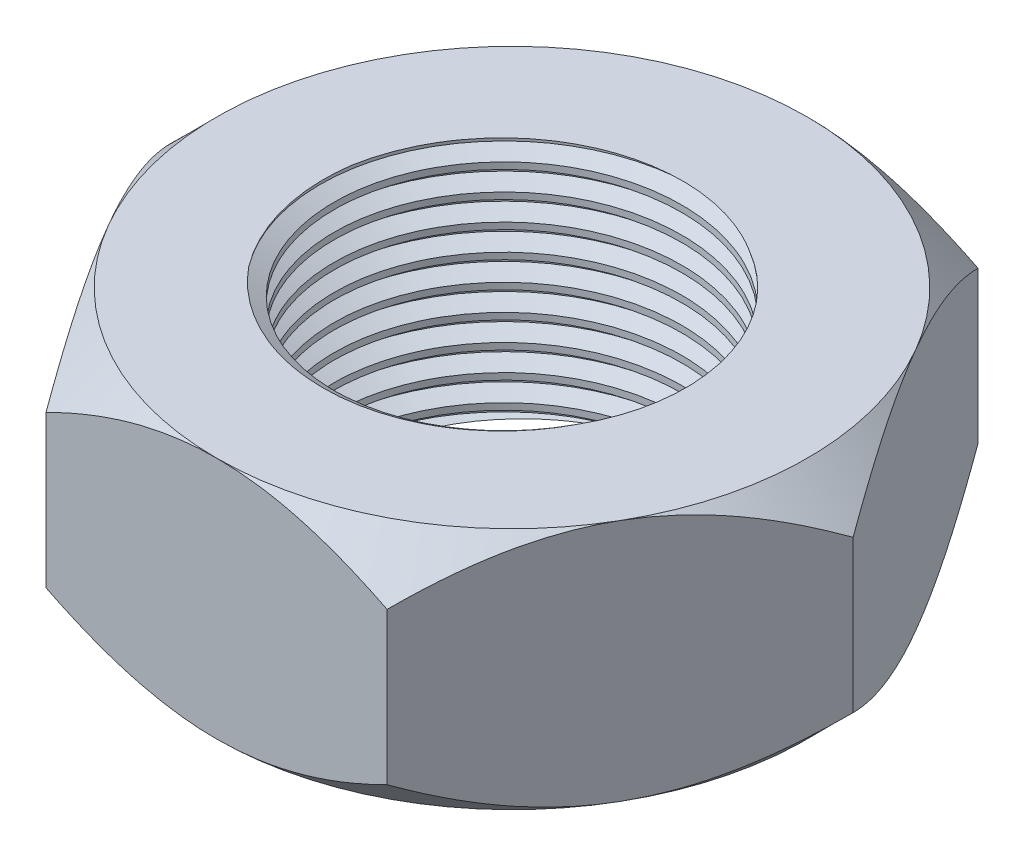
from build123d import *

# Parameters (mm, degrees)
BOSS_EXTRUDE1_DEPTH          = 7
SKETCH2_OUTSIDE_W            = 80.018
SKETCH2_OUTSIDE_H            = 74.758
SKETCH2_OUTSIDE_R            = 17
CUT_EXTRUDE1_DEPTH           = 7
CUT_EXTRUDE1_TAPER           = 45
CUT_EXTRUDE1_OTHER_WAY_DEPTH = 7
CUT_EXTRUDE1_OTHER_WAY_DRAFT = -45
MIRROR1_COPY_1_SKETCH_W      = 80.018
MIRROR1_COPY_1_SKETCH_H      = 74.758
MIRROR1_COPY_1_SKETCH_R      = 17
MIRROR1_COPY_1_DEPTH         = 7
MIRROR1_COPY_1_DRAFT         = -45
MIRROR1_COPY_2_SKETCH_W      = 80.018
MIRROR1_COPY_2_SKETCH_H      = 74.758
MIRROR1_COPY_2_SKETCH_R      = 17
MIRROR1_COPY_2_DEPTH         = 7
MIRROR1_COPY_2_DRAFT         = -45
CUT_EXTRUDE2_REACH           = 31.501
SKETCH3_R                    = 10
THREAD1_PITCH                = 1.5


with BuildPart() as part:
    # Sketch1 → Boss-Extrude1 (new, symmetric)
    with BuildSketch(Plane(origin=(0, 0, 0), x_dir=(1, 0, 0), z_dir=(0, 1, 0))):
        Polygon((19.629909152, 0), (9.814954576, 17), (-9.814954576, 17), (-19.629909152, 0), (-9.814954576, -17), (9.814954576, -17), align=None)
    extrude(amount=BOSS_EXTRUDE1_DEPTH, both=True)

    # Sketch2 outside → Cut-Extrude1 (cut)
    with BuildSketch(Plane(origin=(0, 7, 0), x_dir=(1, 0, 0), z_dir=(0, 1, 0))):
        Rectangle(SKETCH2_OUTSIDE_W, SKETCH2_OUTSIDE_H)
        Circle(SKETCH2_OUTSIDE_R, mode=Mode.SUBTRACT)
    cut_extrude1 = extrude(amount=CUT_EXTRUDE1_DEPTH, taper=CUT_EXTRUDE1_TAPER, mode=Mode.SUBTRACT)


with BuildPart() as cut_extrude1_other_way_tool:
    # Sketch2 outside → Cut-Extrude1 other way (with draft: the straight prism first)
    with BuildSketch(Plane(origin=(0, 7, 0), x_dir=(1, 0, 0), z_dir=(0, 1, 0))):
        Rectangle(SKETCH2_OUTSIDE_W, SKETCH2_OUTSIDE_H)
        Circle(SKETCH2_OUTSIDE_R, mode=Mode.SUBTRACT)
    extrude(amount=-CUT_EXTRUDE1_OTHER_WAY_DEPTH)
    # Cut-Extrude1 other way: the draft: its side faces are tilted about the plane it starts from
    cut_extrude1_other_way_sides = [cut_extrude1_other_way_tool.faces().sort_by_distance(p)[0] for p in [
        (0, 3.5, 37.379),
        (40.009, 3.5, 0),
        (0, 3.5, -37.379),
        (-40.009, 3.5, 0),
        (-17, 3.5, 0),
    ]]
    draft(cut_extrude1_other_way_sides, Plane(origin=(0, 7, 0), x_dir=(1, 0, 0), z_dir=(0, 1, 0)), CUT_EXTRUDE1_OTHER_WAY_DRAFT)


with BuildPart() as part_1:
    add(part.part)

    # Cut-Extrude1 other way: cut by cut_extrude1_other_way_tool
    add(cut_extrude1_other_way_tool.part, mode=Mode.SUBTRACT)

    # Mirror1: Cut-Extrude1 across plane
    add(cut_extrude1.mirror(Plane.ZX), mode=Mode.SUBTRACT)


with BuildPart() as mirror1_copy_1_tool:
    # Mirror1 copy 1 sketch → Mirror1 copy 1 (with draft: the straight prism first)
    with BuildSketch(Plane.XZ.offset(7)):
        Rectangle(MIRROR1_COPY_1_SKETCH_W, MIRROR1_COPY_1_SKETCH_H)
        Circle(MIRROR1_COPY_1_SKETCH_R, mode=Mode.SUBTRACT)
    extrude(amount=-MIRROR1_COPY_1_DEPTH)
    # Mirror1 copy 1: the draft: its side faces are tilted about the plane it starts from
    mirror1_copy_1_sides = [mirror1_copy_1_tool.faces().sort_by_distance(p)[0] for p in [
        (0, -3.5, 37.379),
        (40.009, -3.5, 0),
        (0, -3.5, -37.379),
        (-40.009, -3.5, 0),
        (-17, -3.5, 0),
    ]]
    draft(mirror1_copy_1_sides, Plane.XZ.offset(7), MIRROR1_COPY_1_DRAFT)


with BuildPart() as part_2:
    add(part_1.part)

    # Mirror1 copy 1: cut by mirror1_copy_1_tool
    add(mirror1_copy_1_tool.part, mode=Mode.SUBTRACT)


with BuildPart() as mirror1_copy_2_tool:
    # Mirror1 copy 2 sketch → Mirror1 copy 2 (with draft: the straight prism first)
    with BuildSketch(Plane.XZ.offset(7)):
        Rectangle(MIRROR1_COPY_2_SKETCH_W, MIRROR1_COPY_2_SKETCH_H)
        Circle(MIRROR1_COPY_2_SKETCH_R, mode=Mode.SUBTRACT)
    extrude(amount=-MIRROR1_COPY_2_DEPTH)
    # Mirror1 copy 2: the draft: its side faces are tilted about the plane it starts from
    mirror1_copy_2_sides = [mirror1_copy_2_tool.faces().sort_by_distance(p)[0] for p in [
        (0, -3.5, 37.379),
        (40.009, -3.5, 0),
        (0, -3.5, -37.379),
        (-40.009, -3.5, 0),
        (-17, -3.5, 0),
    ]]
    draft(mirror1_copy_2_sides, Plane.XZ.offset(7), MIRROR1_COPY_2_DRAFT)


with BuildPart() as part_3:
    add(part_2.part)

    # Mirror1 copy 2: cut by mirror1_copy_2_tool
    add(mirror1_copy_2_tool.part, mode=Mode.SUBTRACT)

    # Sketch3 → Cut-Extrude2 (cut, up to next)
    with BuildSketch(Plane(origin=(0, 7, 0), x_dir=(1, 0, 0), z_dir=(0, 1, 0)), mode=Mode.PRIVATE) as cut_extrude2_sk1:
        with Locations(Location((0, 0, 0), (0, 0, 270))):
            Circle(SKETCH3_R)
    cut_extrude2_tool1 = extrude(cut_extrude2_sk1.sketch, amount=-CUT_EXTRUDE2_REACH, mode=Mode.PRIVATE) & part_3.part
    add(cut_extrude2_tool1.solids().sort_by_distance((0, 7, 0))[0], mode=Mode.SUBTRACT)

    # Thread1: the profile of Thread Profile1 profile screwed along a right-hand helix of 12 turns, 8 arcs to a turn; built about Z, then put on its axis
    thread1_z = Axis((0, 0, 0), (0, 0, 1))
    thread1_corners = [(9.9997, 0, -0.000173205), (10.811898813, 0, 0.468749998), (10.811898813, 0, 0.656249998), (9.9997, 0, 1.125173201)]
    with BuildLine(mode=Mode.PRIVATE) as thread1_profile:
        Line(thread1_corners[0], thread1_corners[1])
        Line(thread1_corners[1], thread1_corners[2])
        Line(thread1_corners[2], thread1_corners[3])
        Line(thread1_corners[3], thread1_corners[0])
    thread1_cap = Face(thread1_profile.wire())
    thread1_turn_angles = [0, 22.5, 45, 67.5, 90, 112.5, 135, 157.5, 180, 202.5, 225, 247.5, 270, 292.5, 315, 337.5, 360]
    thread1_turn_weights = [1, 0.9238795325112867, 1, 0.9238795325112867, 1, 0.9238795325112867, 1, 0.9238795325112867, 1, 0.9238795325112867, 1, 0.9238795325112867, 1, 0.9238795325112867, 1, 0.9238795325112867, 1]
    thread1_turn_rails = [Edge.make_bspline([Vector(p[0], p[1], 0).rotate(thread1_z, thread1_turn_angles[k]) / thread1_turn_weights[k] + Vector(0, 0, p[2] + THREAD1_PITCH * thread1_turn_angles[k] / 360) for k in range(17)], [0, 0, 0, 1, 1, 2, 2, 3, 3, 4, 4, 5, 5, 6, 6, 7, 7, 8, 8, 8], 2, thread1_turn_weights) for p in thread1_corners]
    thread1_turn_sides = [Face.make_surface_from_curves(thread1_turn_rails[p[0]], thread1_turn_rails[p[1]]) for p in [(0, 1), (1, 2), (2, 3), (3, 0)]]
    thread1 = Plane(origin=(0, 9, 0), x_dir=(-1, 0, 0), z_dir=(0, -1, 0)) * Solid(Shell([*[p.moved(Location((0, 0, THREAD1_PITCH * i))) for i in range(12) for p in thread1_turn_sides], thread1_cap, thread1_cap.rotate(thread1_z, 4320).moved(Location((0, 0, THREAD1_PITCH * 4320 / 360)))]))
    add(thread1, mode=Mode.SUBTRACT)


solid = part_3.part
